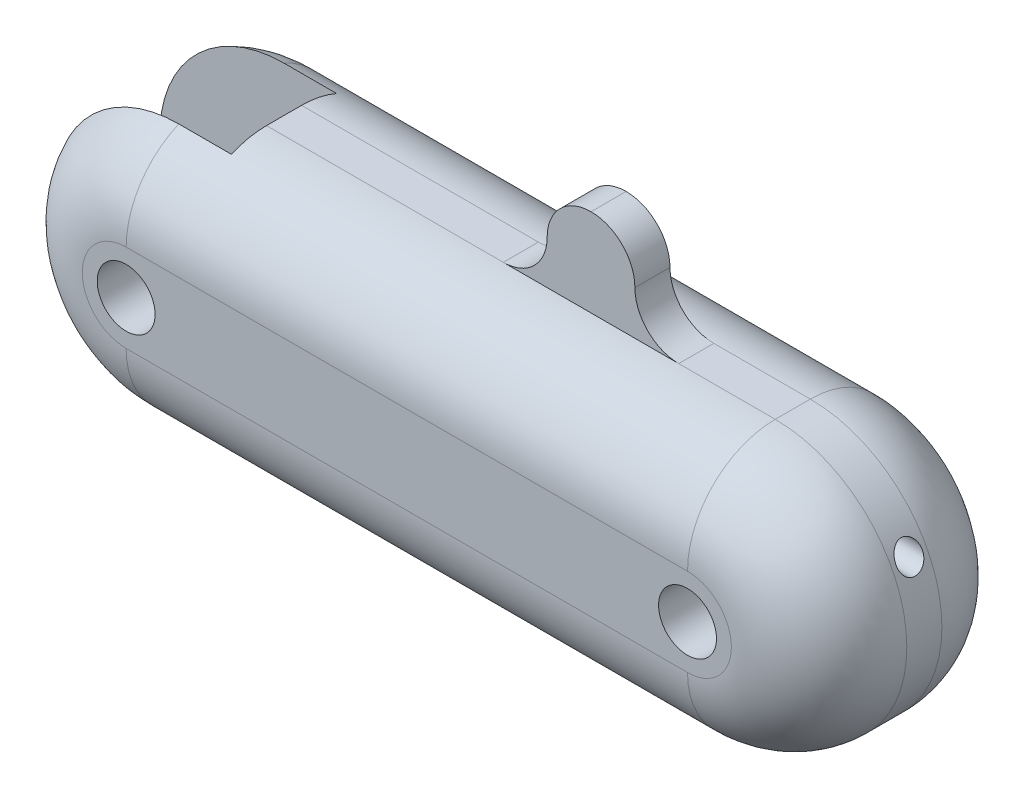
from build123d import *

# Parameters (mm, degrees)
BOSS_EXTRUDE1_DEPTH = 12
FILLET1_R           = 5
SKETCH5_W           = 10.5
SKETCH5_H           = 6
CUT_EXTRUDE3_DEPTH  = 37.349002737
SKETCH6_W           = 5
SKETCH6_H           = 2
BOSS_EXTRUDE2_DEPTH = 5
FILLET2_R           = 2.5
FILLET3_R           = 2.5
SKETCH3_R           = 1.65
CUT_EXTRUDE4_DEPTH  = 31.352100461
SKETCH8_R           = 0.75
CUT_EXTRUDE7_DEPTH  = 51.387859352
SKETCH9_R           = 0.75
CUT_EXTRUDE9_DEPTH  = 23.34523506


with BuildPart() as part:
    # Sketch2 → Boss-Extrude1 (new body)
    with BuildSketch(Plane.XY):
        with BuildLine():
            Line((-16, 0), (16, 0))
            ThreePointArc((16, 0), (23.5, -7.5), (16, -15))
            Line((16, -15), (-16, -15))
            ThreePointArc((-16, -15), (-23.5, -7.5), (-16, 0))
        make_face()
    extrude(amount=BOSS_EXTRUDE1_DEPTH)

    # Fillet1
    fillet1_edges = [part.edges().sort_by_distance(p)[0] for p in [
        (-23.5, -7.5, 12),
        (0, -15, 12),
        (23.5, -7.5, 12),
        (0, -15, 0),
        (-23.5, -7.5, 0),
        (0, 0, 0),
        (23.5, -7.5, 0),
        (0, 0, 12),
    ]]
    fillet(fillet1_edges, radius=FILLET1_R)

    # Sketch5 → Cut-Extrude3 (cut, through all)
    with BuildSketch(Plane(origin=(0, -25, 0), x_dir=(-1, 0, 0), z_dir=(0, -1, 0))):
        with Locations((18.25, -6)):
            Rectangle(SKETCH5_W, SKETCH5_H)
    extrude(amount=-CUT_EXTRUDE3_DEPTH, mode=Mode.SUBTRACT)

    # Sketch6 → Boss-Extrude2 (add)
    with BuildSketch(Plane(origin=(0, 0, 0), x_dir=(1, 0, 0), z_dir=(0, 1, 0))):
        with Locations((5.5, -6)):
            Rectangle(SKETCH6_W, SKETCH6_H)
    extrude(amount=BOSS_EXTRUDE2_DEPTH)

    # Fillet2
    fillet2_edges = [part.edges().sort_by_distance(p)[0] for p in [
        (8, 5, 6),
        (3, 5, 6),
    ]]
    fillet(fillet2_edges, radius=FILLET2_R - 0.0001)  # a hair under: the kernel refuses the full size

    # Fillet3
    fillet3_edges = [part.edges().sort_by_distance(p)[0] for p in [
        (3, 0, 6),
        (8, 0, 6),
    ]]
    fillet(fillet3_edges, radius=FILLET3_R)

    # Sketch3 → Cut-Extrude4 (cut, through all)
    with BuildSketch(Plane.XY.offset(12)):
        with Locations((-16, -7.5)):
            Circle(SKETCH3_R)
        with Locations((16, -7.5)):
            Circle(SKETCH3_R)
    extrude(amount=-CUT_EXTRUDE4_DEPTH, mode=Mode.SUBTRACT)

    # Sketch8 → Cut-Extrude7 (cut, through all)
    with BuildSketch(Plane(origin=(23.5, 0, 0), x_dir=(0, 0, -1), z_dir=(1, 0, 0))):
        with Locations((-6, -4)):
            Circle(SKETCH8_R)
    extrude(amount=-CUT_EXTRUDE7_DEPTH, mode=Mode.SUBTRACT)

    # Sketch9 → Cut-Extrude9 (cut, along a direction that is not the sketch's normal)
    with BuildSketch(Plane.ZY.offset(13)):
        with Locations((6, -11)):
            Circle(SKETCH9_R)
    extrude(amount=-CUT_EXTRUDE9_DEPTH, dir=(-0.9852117548196745, 0.17134117475124766, 0), mode=Mode.SUBTRACT)


solid = part.part
